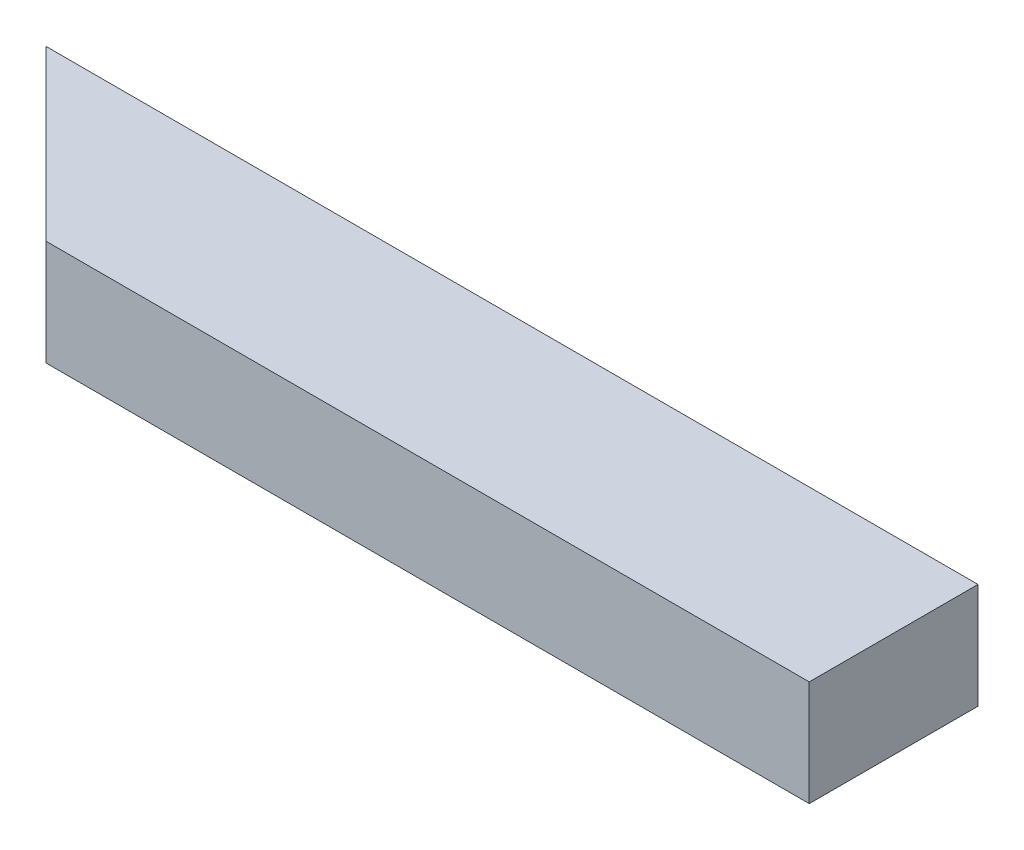
from build123d import *

# Parameters (mm, degrees)
SKETCH2_W           = 28.055216984
SKETCH2_H           = 3.175
BOSS_EXTRUDE1_DEPTH = 5.08
CHAMFER1_SIZE       = 5.08


with BuildPart() as part:
    # Sketch2 → Boss-Extrude1 (new body)
    with BuildSketch(Plane.XY):
        with Locations((-230.698767432, -9.525)):
            Rectangle(SKETCH2_W, SKETCH2_H)
    extrude(amount=BOSS_EXTRUDE1_DEPTH)

    # Chamfer1
    chamfer1_edges = [part.edges().sort_by_distance(p)[0] for p in [
        (-244.726375924, -9.525, 5.08),
    ]]
    chamfer(chamfer1_edges, length=CHAMFER1_SIZE - 0.0001)  # a hair under: the kernel refuses the full size


solid = part.part
